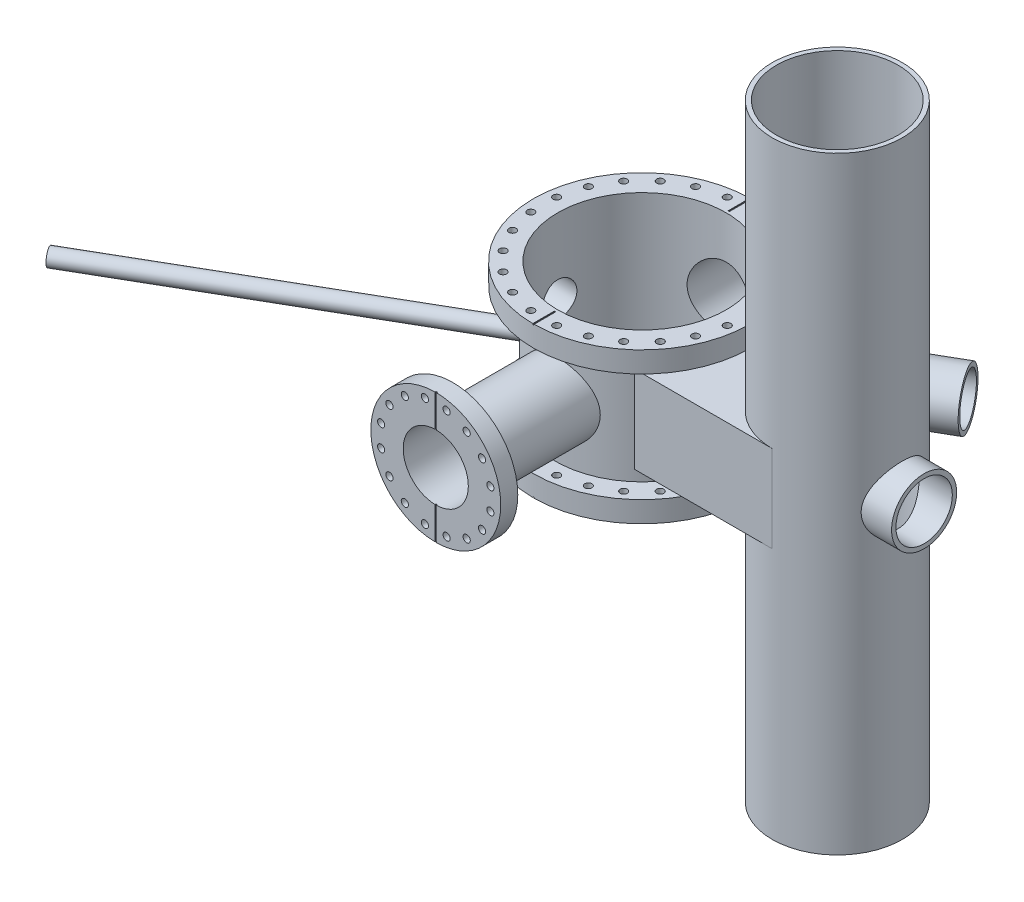
from build123d import *

# Parameters (mm, degrees)
MAIN_CHAMBER_CYLINDER_DEPTH             = 88.138
MAIN_CHAMBER_CYLINDER_DEPTH_BACK        = 88.138
MAIN_CHAMBER_CYLINDER_CROSS_SECTION_R   = 101.6
MAIN_CHAMBER_CYLINDER_CROSS_SECTION_R_2 = 98.552
SKETCH21_R                              = 127
SKETCH21_R_2                            = 101.6
EXTRUDE2_DEPTH                          = 24.5
SKETCH5_W                               = 1.5875
SKETCH5_H                               = 50.8
EXTRUDE3_DEPTH                          = 1.016
HOLE5_D                                 = 8.4
CIRPATTERN7_COUNT                       = 24
EXTRUDE21_START                         = -24.5
SKETCH22_R                              = 127
SKETCH22_R_2                            = 101.6
EXTRUDE21_DEPTH                         = 24.5
SKETCH51_W                              = 1.5875
SKETCH51_H                              = 50.8
EXTRUDE31_DEPTH                         = 1.016
HOLE51_D                                = 8.4
CIRPATTERN71_COUNT                      = 24
EXTRUDE32_REACH                         = 401.427
EXTRUDE32_END_RADIUS                    = 101.6
SKETCH92_R                              = 43.18
SKETCH92_R_2                            = 38.1
EXTRUDE33_REACH                         = 401.427
SKETCH93_R                              = 38.1
SKETCH23_R                              = 76.0000004
SKETCH23_R_2                            = 38.1
EXTRUDE22_DEPTH                         = 20
SKETCH52_W                              = 1.5875
SKETCH52_H                              = 152.0000008
EXTRUDE35_DEPTH                         = 1.016
EXTRUDE4_REACH                          = 401.427
SKETCH8_R                               = 4.2
CIRPATTERN1_COUNT                       = 16
SKETCH24_R                              = 76.0000004
SKETCH24_R_2                            = 38.1
EXTRUDE23_DEPTH                         = 20
SKETCH53_W                              = 1.5875
SKETCH53_H                              = 152.0000008
EXTRUDE36_DEPTH                         = 1.016
EXTRUDE41_REACH                         = 508.754
SKETCH81_R                              = 4.2
CIRPATTERN11_COUNT                      = 16
EXTRUDE42_REACH                         = 440.686
EXTRUDE42_END_RADIUS                    = 101.6
SKETCH96_W                              = 152.4
SKETCH96_H                              = 101.6
SKETCH98_R                              = 76.2
EXTRUDE44_DEPTH                         = 711.2
SKETCH99_R                              = 71.12
EXTRUDE45_DEPTH                         = 711.2
EXTRUDE50_REACH                         = 566.32
EXTRUDE50_END_RADIUS                    = 98.552
SKETCH106_W                             = 142.24
SKETCH106_H                             = 91.44
EXTRUDE46_REACH                         = 635.276
EXTRUDE46_END_RADIUS                    = 76.2
SKETCH100_R                             = 38.1
EXTRUDE47_REACH                         = 635.276
EXTRUDE47_END_RADIUS                    = 71.12
SKETCH101_R                             = 33.02
EXTRUDE48_REACH                         = 653.85
EXTRUDE48_END_RADIUS                    = 101.6
SKETCH102_R                             = 25.4
EXTRUDE49_REACH                         = 653.85
EXTRUDE49_END_RADIUS                    = 98.552
SKETCH103_R                             = 20.32
EXTRUDE51_REACH                         = 988.012
EXTRUDE51_END_RADIUS                    = 101.6
SKETCH108_R                             = 9.525
EXTRUDE52_REACH                         = 988.012
EXTRUDE52_END_RADIUS                    = 98.552
SKETCH109_R                             = 8.636
EXTRUDE53_REACH                         = 877.706
SKETCH110_R                             = 31.75
EXTRUDE54_REACH                         = 877.706
SKETCH111_R                             = 26.67


with BuildPart() as part:
    # Main_Chamber_Cylinder_Cross_Section → Main_Chamber_Cylinder (new, two sides: drawn at the far end of the back side and taken through both)
    with BuildSketch(Plane(origin=(0, 0, 0), x_dir=(1, 0, 0), z_dir=(0, 1, 0)).offset(-MAIN_CHAMBER_CYLINDER_DEPTH_BACK)):
        with Locations(Location((0, 0, 0), (0, 0, 270))):
            Circle(MAIN_CHAMBER_CYLINDER_CROSS_SECTION_R)
        with Locations(Location((0, 0, 0), (0, 0, 270))):
            Circle(MAIN_CHAMBER_CYLINDER_CROSS_SECTION_R_2, mode=Mode.SUBTRACT)
    extrude(amount=MAIN_CHAMBER_CYLINDER_DEPTH + MAIN_CHAMBER_CYLINDER_DEPTH_BACK)

    # Sketch21 → Extrude2 (add)
    with BuildSketch(Plane.XZ.offset(88.138)):
        with Locations(Location((0, 0, 0), (0, 0, 270))):
            Circle(SKETCH21_R)
        with Locations(Location((0, 0, 0), (0, 0, 270))):
            Circle(SKETCH21_R_2, mode=Mode.SUBTRACT)
    extrude(amount=-EXTRUDE2_DEPTH)

    # Sketch5 → Extrude3 (cut)
    with BuildSketch(Plane.XZ.offset(88.138)):
        with Locations((0, 127.0500126)):
            Rectangle(SKETCH5_W, SKETCH5_H)
        with Locations((0, -127.0500126)):
            Rectangle(SKETCH5_W, SKETCH5_H)
    extrude(amount=-EXTRUDE3_DEPTH, mode=Mode.SUBTRACT)

    # Hole5 (through all)
    with Locations(Plane(origin=(15.131327149, -88.138, 114.933840422), x_dir=(0, 0, -1), z_dir=(0, -1, 0))):
        with Locations((0, 0)):
            hole5 = Hole(HOLE5_D / 2)

    # CirPattern7: Hole5 ×24 about axis
    cirpattern7_axis = Axis((0, 0, 0), (0, 1, 0))
    for i in range(1, CIRPATTERN7_COUNT):
        add(hole5.rotate(cirpattern7_axis, i * 360 / CIRPATTERN7_COUNT), mode=Mode.SUBTRACT)

    # Sketch22 → Extrude21 (add)
    with BuildSketch(Plane(origin=(0, 88.138, 0), x_dir=(-1, 0, 0), z_dir=(0, 1, 0)).offset(EXTRUDE21_START)):
        with Locations(Location((0, 0, 0), (0, 0, 270))):
            Circle(SKETCH22_R)
        with Locations(Location((0, 0, 0), (0, 0, 270))):
            Circle(SKETCH22_R_2, mode=Mode.SUBTRACT)
    extrude(amount=EXTRUDE21_DEPTH)

    # Sketch51 → Extrude31 (cut)
    with BuildSketch(Plane(origin=(0, 88.138, 0), x_dir=(-1, 0, 0), z_dir=(0, 1, 0))):
        with Locations((0, -127.0500126)):
            Rectangle(SKETCH51_W, SKETCH51_H)
        with Locations((0, 127.0500126)):
            Rectangle(SKETCH51_W, SKETCH51_H)
    extrude(amount=-EXTRUDE31_DEPTH, mode=Mode.SUBTRACT)

    # Hole51 (through all)
    with Locations(Plane(origin=(15.131327149, 88.138, -114.933840422), x_dir=(0, 0, 1), z_dir=(0, 1, 0))):
        with Locations((0, 0)):
            hole51 = Hole(HOLE51_D / 2)

    # CirPattern71: Hole51 ×24 about axis
    cirpattern71_axis = Axis((0, 0, 0), (0, 1, 0))
    for i in range(1, CIRPATTERN71_COUNT):
        add(hole51.rotate(cirpattern71_axis, i * 360 / CIRPATTERN71_COUNT), mode=Mode.SUBTRACT)

    # Extrude32: up to this cylinder (the profile starts outside it)
    extrude32_end = Plane(origin=(0, 0, 0), z_dir=(0, -1, 0)) * Cylinder(EXTRUDE32_END_RADIUS, 1007.054, mode=Mode.PRIVATE)
    # Sketch92 → Extrude32 (add, up to the surface)
    with BuildSketch(Plane.XY.offset(241.3), mode=Mode.PRIVATE) as extrude32_sk1:
        Circle(SKETCH92_R)
        Circle(SKETCH92_R_2, mode=Mode.SUBTRACT)
    extrude32_tool1 = extrude(extrude32_sk1.sketch, amount=-EXTRUDE32_REACH, mode=Mode.PRIVATE) - extrude32_end
    extrude32 = extrude32_tool1.solids().sort_by_distance((-41.958685, 0, 241.3))[0]
    add(extrude32)

    # Sketch93 → Extrude33 (cut, up to next)
    with BuildSketch(Plane.XY.offset(241.3), mode=Mode.PRIVATE) as extrude33_sk1:
        Circle(SKETCH93_R)
    extrude33_tool1 = extrude(extrude33_sk1.sketch, amount=-EXTRUDE33_REACH, mode=Mode.PRIVATE) & part.part
    extrude33 = extrude33_tool1.solids().sort_by_distance((0, 0, 241.3))[0]
    add(extrude33, mode=Mode.SUBTRACT)

    # Sketch23 → Extrude22 (add)
    with BuildSketch(Plane.XY.offset(241.3)):
        Circle(SKETCH23_R)
        Circle(SKETCH23_R_2, mode=Mode.SUBTRACT)
    extrude(amount=-EXTRUDE22_DEPTH)

    # Sketch52 → Extrude35 (cut)
    with BuildSketch(Plane.XY.offset(241.3)):
        Rectangle(SKETCH52_W, SKETCH52_H)
    extrude(amount=-EXTRUDE35_DEPTH, mode=Mode.SUBTRACT)

    # Sketch8 → Extrude4 (cut, up to next)
    with BuildSketch(Plane.XY.offset(241.3), mode=Mode.PRIVATE) as extrude4_sk1:
        with Locations((12.710134479, 63.898161018)):
            Circle(SKETCH8_R)
    extrude4_tool1 = extrude(extrude4_sk1.sketch, amount=-EXTRUDE4_REACH, mode=Mode.PRIVATE) & part.part
    extrude4 = extrude4_tool1.solids().sort_by_distance((12.710134, 63.898161, 241.3))[0]
    add(extrude4, mode=Mode.SUBTRACT)

    # CirPattern1: Extrude4 ×16 about axis
    cirpattern1_axis = Axis((0, 0, 0), (0, 0, 1))
    for i in range(1, CIRPATTERN1_COUNT):
        add(extrude4.rotate(cirpattern1_axis, i * 360 / CIRPATTERN1_COUNT), mode=Mode.SUBTRACT)

    # Mirror2: Extrude32, Extrude33 across plane
    add(extrude32.mirror(Plane.XY))
    add(extrude33.mirror(Plane.XY), mode=Mode.SUBTRACT)

    # Sketch24 → Extrude23 (add)
    with BuildSketch(Plane(origin=(0, 0, -241.3), x_dir=(-1, 0, 0), z_dir=(0, 0, -1))):
        with Locations(Location((0, 0, 0), (0, 0, 180))):
            Circle(SKETCH24_R)
        with Locations(Location((0, 0, 0), (0, 0, 180))):
            Circle(SKETCH24_R_2, mode=Mode.SUBTRACT)
    extrude(amount=-EXTRUDE23_DEPTH)

    # Sketch53 → Extrude36 (cut)
    with BuildSketch(Plane(origin=(0, 0, -241.3), x_dir=(-1, 0, 0), z_dir=(0, 0, -1))):
        Rectangle(SKETCH53_W, SKETCH53_H)
    extrude(amount=-EXTRUDE36_DEPTH, mode=Mode.SUBTRACT)

    # Sketch81 → Extrude41 (cut, up to next)
    with BuildSketch(Plane(origin=(0, 0, -241.3), x_dir=(-1, 0, 0), z_dir=(0, 0, -1)), mode=Mode.PRIVATE) as extrude41_sk1:
        with Locations(Location((12.710134479, 63.898161018, 0), (0, 0, 180))):
            Circle(SKETCH81_R)
    extrude41_tool1 = extrude(extrude41_sk1.sketch, amount=-EXTRUDE41_REACH, mode=Mode.PRIVATE) & part.part
    extrude41 = extrude41_tool1.solids().sort_by_distance((-12.710134, 63.898161, -241.3))[0]
    add(extrude41, mode=Mode.SUBTRACT)

    # CirPattern11: Extrude41 ×16 about axis
    cirpattern11_axis = Axis((0, 0, 0), (0, 0, 1))
    for i in range(1, CIRPATTERN11_COUNT):
        add(extrude41.rotate(cirpattern11_axis, i * 360 / CIRPATTERN11_COUNT), mode=Mode.SUBTRACT)

    # Extrude42: up to this cylinder (the profile starts outside it)
    extrude42_end = Plane(origin=(0, 0, 0), z_dir=(0, -1, 0)) * Cylinder(EXTRUDE42_END_RADIUS, 1085.572, mode=Mode.PRIVATE)
    # Sketch96 → Extrude42 (add, up to the surface)
    with BuildSketch(Plane(origin=(228.6, 0, 0), x_dir=(0, 0, -1), z_dir=(1, 0, 0)), mode=Mode.PRIVATE) as extrude42_sk1:
        Rectangle(SKETCH96_W, SKETCH96_H)
    extrude42_tool1 = extrude(extrude42_sk1.sketch, amount=-EXTRUDE42_REACH, mode=Mode.PRIVATE) - extrude42_end
    add(extrude42_tool1.solids().sort_by_distance((228.6, 0, 0))[0])

    # Sketch98 → Extrude44 (add)
    with BuildSketch(Plane(origin=(0, 365.76, 0), x_dir=(-1, 0, 0), z_dir=(0, 1, 0))):
        with Locations(Location((-228.6, 0, 0), (0, 0, 90))):
            Circle(SKETCH98_R)
    extrude(amount=-EXTRUDE44_DEPTH)

    # Sketch99 → Extrude45 (cut)
    with BuildSketch(Plane(origin=(0, 365.76, 0), x_dir=(1, 0, 0), z_dir=(0, 1, 0))):
        with Locations(Location((228.6, 0, 0), (0, 0, 270))):
            Circle(SKETCH99_R)
    extrude(amount=-EXTRUDE45_DEPTH, mode=Mode.SUBTRACT)

    # Extrude50: up to this cylinder (the profile starts outside it)
    extrude50_end = Plane(origin=(0, 0, 0), z_dir=(0, -1, 0)) * Cylinder(EXTRUDE50_END_RADIUS, 1330.744, mode=Mode.PRIVATE)
    # Sketch106 → Extrude50 (cut, up to the surface)
    with BuildSketch(Plane(origin=(228.6, 0, 0), x_dir=(0, 0, -1), z_dir=(1, 0, 0)), mode=Mode.PRIVATE) as extrude50_sk1:
        Rectangle(SKETCH106_W, SKETCH106_H)
    extrude50_tool1 = extrude(extrude50_sk1.sketch, amount=-EXTRUDE50_REACH, mode=Mode.PRIVATE) - extrude50_end
    add(extrude50_tool1.solids().sort_by_distance((228.6, 0, 0))[0], mode=Mode.SUBTRACT)

    # Extrude46: up to this cylinder (the profile starts outside it)
    extrude46_end = Plane(origin=(228.6, 0, 0), z_dir=(0, 1, 0)) * Cylinder(EXTRUDE46_END_RADIUS, 1423.952, mode=Mode.PRIVATE)
    # Sketch100 → Extrude46 (add, up to the surface)
    with BuildSketch(Plane(origin=(330.2, 0, 0), x_dir=(0, 0, -1), z_dir=(1, 0, 0)), mode=Mode.PRIVATE) as extrude46_sk1:
        Circle(SKETCH100_R)
    extrude46_tool1 = extrude(extrude46_sk1.sketch, amount=-EXTRUDE46_REACH, mode=Mode.PRIVATE) - extrude46_end
    add(extrude46_tool1.solids().sort_by_distance((330.2, 0, 0))[0])

    # Extrude47: up to this cylinder (the profile starts outside it)
    extrude47_end = Plane(origin=(228.6, 0, 0), z_dir=(0, 1, 0)) * Cylinder(EXTRUDE47_END_RADIUS, 1413.792, mode=Mode.PRIVATE)
    # Sketch101 → Extrude47 (cut, up to the surface)
    with BuildSketch(Plane(origin=(330.2, 0, 0), x_dir=(0, 0, -1), z_dir=(1, 0, 0)), mode=Mode.PRIVATE) as extrude47_sk1:
        Circle(SKETCH101_R)
    extrude47_tool1 = extrude(extrude47_sk1.sketch, amount=-EXTRUDE47_REACH, mode=Mode.PRIVATE) - extrude47_end
    add(extrude47_tool1.solids().sort_by_distance((330.2, 0, 0))[0], mode=Mode.SUBTRACT)

    # Extrude48: up to this cylinder (the profile starts outside it)
    extrude48_end = Plane(origin=(0, 0, 0), z_dir=(0, -1, 0)) * Cylinder(EXTRUDE48_END_RADIUS, 1511.9, mode=Mode.PRIVATE)
    # Sketch102 → Extrude48 (add, up to the surface)
    with BuildSketch(Plane(origin=(-152.4, 0, 0), x_dir=(0, 0, -1), z_dir=(1, 0, 0)), mode=Mode.PRIVATE) as extrude48_sk1:
        with Locations(Location((0, 0, 0), (0, 0, 180))):
            Circle(SKETCH102_R)
    extrude48_tool1 = extrude(extrude48_sk1.sketch, amount=EXTRUDE48_REACH, mode=Mode.PRIVATE) - extrude48_end
    add(extrude48_tool1.solids().sort_by_distance((-152.4, 0, 0))[0])

    # Extrude49: up to this cylinder (the profile starts outside it)
    extrude49_end = Plane(origin=(0, 0, 0), z_dir=(0, -1, 0)) * Cylinder(EXTRUDE49_END_RADIUS, 1505.804, mode=Mode.PRIVATE)
    # Sketch103 → Extrude49 (cut, up to the surface)
    with BuildSketch(Plane.ZY.offset(152.4), mode=Mode.PRIVATE) as extrude49_sk1:
        Circle(SKETCH103_R)
    extrude49_tool1 = extrude(extrude49_sk1.sketch, amount=-EXTRUDE49_REACH, mode=Mode.PRIVATE) - extrude49_end
    add(extrude49_tool1.solids().sort_by_distance((-152.4, 0, 0))[0], mode=Mode.SUBTRACT)

    # Extrude51: up to this cylinder (the profile starts outside it)
    extrude51_end = Plane(origin=(0, 0, 0), z_dir=(0, -1, 0)) * Cylinder(EXTRUDE51_END_RADIUS, 2180.224, mode=Mode.PRIVATE)
    # Sketch108 → Extrude51 (add, up to the surface)
    with BuildSketch(Plane(origin=(-439.940905122, 0, 254), x_dir=(0.5000000000000013, 0, 0.8660254037844379), z_dir=(-0.8660254037844379, 0, 0.5000000000000013)), mode=Mode.PRIVATE) as extrude51_sk1:
        Circle(SKETCH108_R)
    extrude51_tool1 = extrude(extrude51_sk1.sketch, amount=-EXTRUDE51_REACH, mode=Mode.PRIVATE) - extrude51_end
    add(extrude51_tool1.solids().sort_by_distance((-439.940905, 0, 254))[0])

    # Extrude52: up to this cylinder (the profile starts outside it)
    extrude52_end = Plane(origin=(0, 0, 0), z_dir=(0, -1, 0)) * Cylinder(EXTRUDE52_END_RADIUS, 2174.128, mode=Mode.PRIVATE)
    # Sketch109 → Extrude52 (cut, up to the surface)
    with BuildSketch(Plane(origin=(-439.940905122, 0, 254), x_dir=(0.5000000000000013, 0, 0.8660254037844379), z_dir=(-0.8660254037844379, 0, 0.5000000000000013)), mode=Mode.PRIVATE) as extrude52_sk1:
        Circle(SKETCH109_R)
    extrude52_tool1 = extrude(extrude52_sk1.sketch, amount=-EXTRUDE52_REACH, mode=Mode.PRIVATE) - extrude52_end
    add(extrude52_tool1.solids().sort_by_distance((-439.940905, 0, 254))[0], mode=Mode.SUBTRACT)

    # Extrude53: up to this plane
    extrude53_end = Plane(origin=(-500000, 50.8, -76.2), z_dir=(0, 0, -1))
    # Sketch110 → Extrude53 (add, up to the surface)
    with BuildSketch(Plane(origin=(241.967497817, 0, -139.7), x_dir=(0.5000000000000013, 0, 0.8660254037844379), z_dir=(-0.8660254037844379, 0, 0.5000000000000013)), mode=Mode.PRIVATE) as extrude53_sk1:
        Circle(SKETCH110_R)
    extrude53_tool1 = split(extrude(extrude53_sk1.sketch, amount=EXTRUDE53_REACH, mode=Mode.PRIVATE), bisect_by=extrude53_end, keep=Keep.BOTH, mode=Mode.PRIVATE)
    add(extrude53_tool1.solids().sort_by_distance((241.967498, 0, -139.7))[0])

    # Extrude54: up to this plane
    extrude54_end = Plane(origin=(-127.001, 45.72, -71.12), z_dir=(0, 0, -1))
    # Sketch111 → Extrude54 (cut, up to the surface)
    with BuildSketch(Plane(origin=(241.967497817, 0, -139.7), x_dir=(-0.5000000000000013, 0, -0.8660254037844379), z_dir=(0.8660254037844379, 0, -0.5000000000000013)), mode=Mode.PRIVATE) as extrude54_sk1:
        Circle(SKETCH111_R)
    extrude54_tool1 = split(extrude(extrude54_sk1.sketch, amount=-EXTRUDE54_REACH, mode=Mode.PRIVATE), bisect_by=extrude54_end, keep=Keep.BOTH, mode=Mode.PRIVATE)
    add(extrude54_tool1.solids().sort_by_distance((241.967498, 0, -139.7))[0], mode=Mode.SUBTRACT)


solid = part.part
